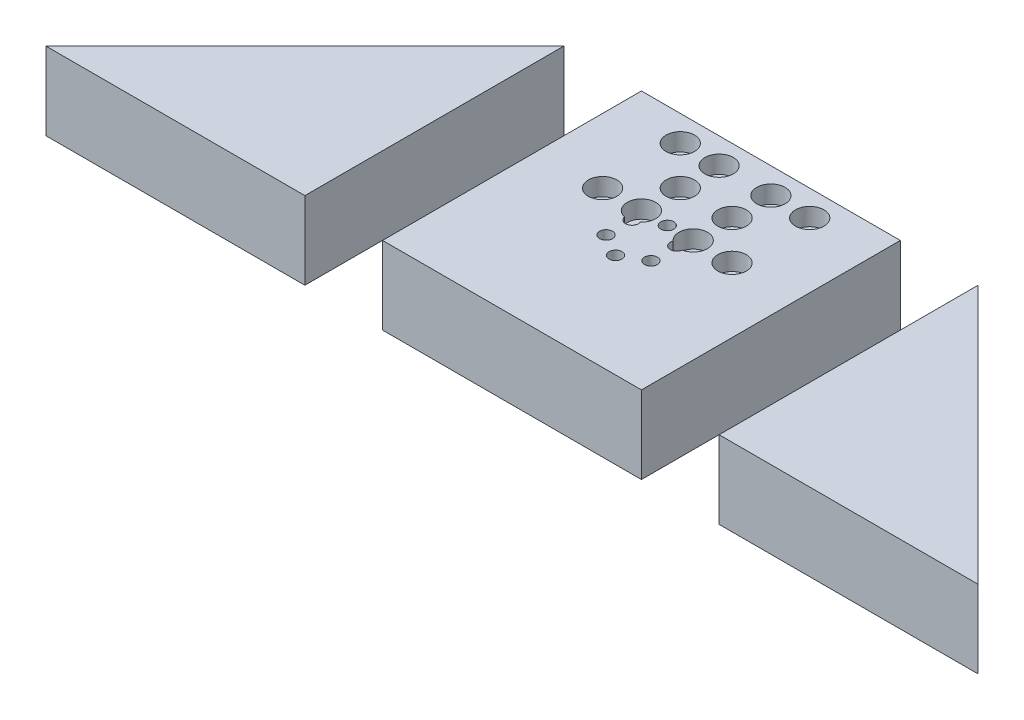
from build123d import *

# Parameters (mm, degrees)
EXTRUDE_1_DEPTH             = 30
SKETCH_1_W                  = 100
SKETCH_1_H                  = 100
EXTRUDE_1_2_DEPTH           = 30
SKETCH_11_W                 = 2.5
SKETCH_11_H                 = 30
PATTERN_LINEAR_1_COUNT      = 2
PATTERN_LINEAR_1_PITCH      = 15
PATTERN_LINEAR_1_COUNT_DIR2 = 3
PATTERN_LINEAR_1_PITCH_DIR2 = 15
PATTERN_CIRCULAR_1_COUNT    = 6


with BuildPart() as part:
    # 草图1 → 凸台-拉伸1 (new body)
    with BuildSketch(Plane(origin=(0, 0, 0), x_dir=(1, 0, 0), z_dir=(0, 1, 0))):
        Polygon((80, -50), (180, -50), (80, 50), align=None)
    extrude(amount=EXTRUDE_1_DEPTH)


with BuildPart() as body_2:
    # 草图1 → Extrude 1 2 (new body)
    with BuildSketch(Plane(origin=(0, 0, 0), x_dir=(1, 0, 0), z_dir=(0, 1, 0))):
        Rectangle(SKETCH_1_W, SKETCH_1_H)
    extrude(amount=EXTRUDE_1_2_DEPTH)

    # 草图4 → 打孔尺寸(%根据)内六角圆柱头螺钉的类型1 (revolve, cut)
    with BuildSketch(Plane(origin=(-25, 30, -10), x_dir=(0, 0, 1), z_dir=(1, 0, 0))):
        Polygon((0, 0), (0, 30), (3.3, 30), (3.3, 6.8), (5.5, 6.8), (5.5, 0), align=None)
    hole_wizard_1 = revolve(axis=Axis((-25, 36.35, -10), (0, -1, 0)), mode=Mode.SUBTRACT)

    # 草图11 → M6 螺纹孔1 (revolve, cut)
    with BuildSketch(Plane(origin=(0, 30, -10), x_dir=(0, 0, 1), z_dir=(1, 0, 0))):
        with Locations((1.25, 15)):
            Rectangle(SKETCH_11_W, SKETCH_11_H)
    hole_wizard_m6_1 = revolve(axis=Axis((0, 36.35, -10), (0, -1, 0)), mode=Mode.SUBTRACT)

    # 阵列(线性)1: Hole Wizard 1 2 × 3, 1 skipped
    with Locations(*[(i * PATTERN_LINEAR_1_PITCH, 0, -j * PATTERN_LINEAR_1_PITCH_DIR2) for i in range(PATTERN_LINEAR_1_COUNT) for j in range(PATTERN_LINEAR_1_COUNT_DIR2) if (i, j) not in ((0, 0), (0, 1))]):
        add(hole_wizard_1, mode=Mode.SUBTRACT)

    # 阵列(圆周)1: M6 螺纹孔1 ×6 about axis
    pattern_circular_1_axis = Axis((0, 0, 0), (0, 1, 0))
    for i in range(1, PATTERN_CIRCULAR_1_COUNT):
        add(hole_wizard_m6_1.rotate(pattern_circular_1_axis, i * 360 / PATTERN_CIRCULAR_1_COUNT), mode=Mode.SUBTRACT)

    # 镜向3 copy 1 sketch → 镜向3 copy 1 (revolve, cut)
    with BuildSketch(Plane(origin=(25, 30, -40), x_dir=(0, 0, 1), z_dir=(-1, 0, 0))):
        Polygon((0, 0), (0, -30), (3.3, -30), (3.3, -6.8), (5.5, -6.8), (5.5, 0), align=None)
    revolve(axis=Axis((25, 36.35, -40), (0, 1, 0)), mode=Mode.SUBTRACT)

    # 镜向3 copy 2 sketch → 镜向3 copy 2 (revolve, cut)
    with BuildSketch(Plane(origin=(10, 30, -10), x_dir=(0, 0, 1), z_dir=(-1, 0, 0))):
        Polygon((0, 0), (0, -30), (3.3, -30), (3.3, -6.8), (5.5, -6.8), (5.5, 0), align=None)
    revolve(axis=Axis((10, 36.35, -10), (0, 1, 0)), mode=Mode.SUBTRACT)

    # 镜向3 copy 3 sketch → 镜向3 copy 3 (revolve, cut)
    with BuildSketch(Plane(origin=(10, 30, -25), x_dir=(0, 0, 1), z_dir=(-1, 0, 0))):
        Polygon((0, 0), (0, -30), (3.3, -30), (3.3, -6.8), (5.5, -6.8), (5.5, 0), align=None)
    revolve(axis=Axis((10, 36.35, -25), (0, 1, 0)), mode=Mode.SUBTRACT)

    # 镜向3 copy 4 sketch → 镜向3 copy 4 (revolve, cut)
    with BuildSketch(Plane(origin=(10, 30, -40), x_dir=(0, 0, 1), z_dir=(-1, 0, 0))):
        Polygon((0, 0), (0, -30), (3.3, -30), (3.3, -6.8), (5.5, -6.8), (5.5, 0), align=None)
    revolve(axis=Axis((10, 36.35, -40), (0, 1, 0)), mode=Mode.SUBTRACT)

    # 镜向3 copy 5 sketch → 镜向3 copy 5 (revolve, cut)
    with BuildSketch(Plane(origin=(25, 30, -10), x_dir=(0, 0, 1), z_dir=(-1, 0, 0))):
        Polygon((0, 0), (0, -30), (3.3, -30), (3.3, -6.8), (5.5, -6.8), (5.5, 0), align=None)
    revolve(axis=Axis((25, 36.35, -10), (0, 1, 0)), mode=Mode.SUBTRACT)


with BuildPart() as body_3:
    # 镜向5: mirrored copy
    add(part.part.mirror(Plane(origin=(0, 0, 0), x_dir=(0, 0, 1), z_dir=(1, 0, 0))))


solid = Compound([part.part, body_2.part, body_3.part])
